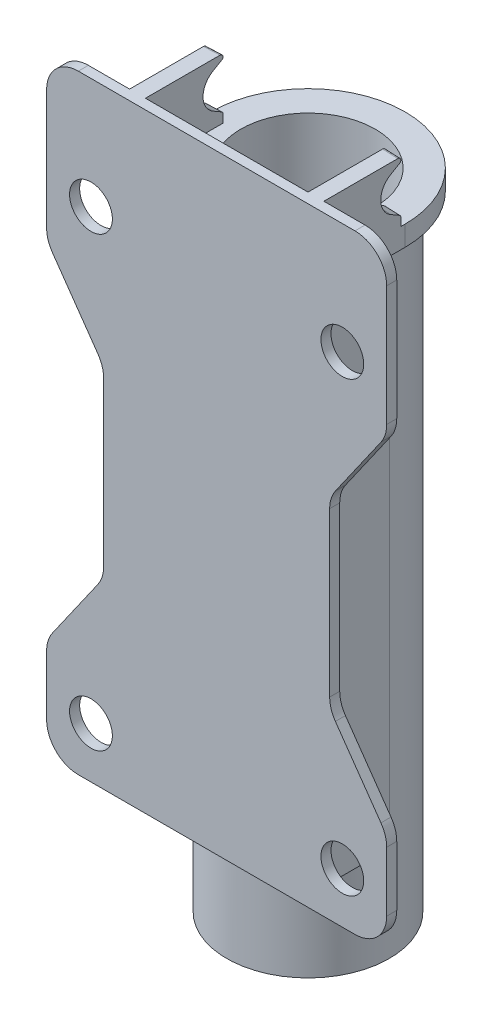
from build123d import *

# Parameters (mm, degrees)
BOSS_EXTRUDE1_START   = -173.2
BOSS_EXTRUDE1_DEPTH   = 173.2
BOSS_EXTRUDE2_DEPTH   = 3.175
M12_CLEARANCE_HOLE1_D = 13.5
FILLET1_R             = 10
FILLET1_OF_MIRROR1_R  = 10
BOSS_EXTRUDE3_DEPTH   = 6.35
BOSS_EXTRUDE4_DEPTH   = 19.05
CUT_EXTRUDE1_DEPTH    = 238.82533849
FILLET2_R             = 1
FILLET2_OF_MIRROR2_R  = 1


with BuildPart() as part:
    # Sketch12 → Revolve1 (revolve)
    with BuildSketch(Plane.XY, mode=Mode.PRIVATE) as revolve1_sk:
        Polygon((-25.65, 0), (-25.65, 203.2), (-21.22866, 203.2), (-21.22866, 164.7), (-19.177, 164.7), (-19.177, 38.5), (-21.22866, 38.5), (-21.22866, 0), align=None)
    revolve(revolve1_sk.sketch.rotate(Axis((0, 0, 0), (0, 1, 0)), 270), axis=Axis((0, 0, 0), (0, 1, 0)))

    # Sketch14 → Boss-Extrude1 (add)
    with BuildSketch(Plane(origin=(0, 30, 0), x_dir=(-1, 0, 0), z_dir=(0, -1, 0)).offset(BOSS_EXTRUDE1_START)):
        with BuildLine():
            Line((-25.65, 0), (-25.65, -25.65))
            Line((-25.65, -25.65), (1.5e-08, -25.65))
            ThreePointArc((1.5e-08, -25.65), (-18.137288932, -18.137288943), (-25.65, 0))
        make_face()
        with BuildLine():
            ThreePointArc((25.65, 0), (18.137288943, -18.137288932), (1.5e-08, -25.65))
            Line((1.5e-08, -25.65), (25.65, -25.65))
            Line((25.65, -25.65), (25.65, 0))
        make_face()
    extrude(amount=BOSS_EXTRUDE1_DEPTH)

    # Sketch27 → Boss-Extrude2 (add)
    with BuildSketch(Plane.XY.offset(25.65)):
        Polygon((-25.65, 30), (53.65, 30), (53.65, 62), (35.65, 87.706664121), (35.65, 145.493335879), (53.65, 171.2), (53.65, 222.25), (-25.65, 222.25), align=None)
    boss_extrude2 = extrude(amount=BOSS_EXTRUDE2_DEPTH)

    # M12 Clearance Hole1 (through all)
    with Locations(Plane(origin=(0, 0, 25.65), x_dir=(-1, 0, 0), z_dir=(0, 0, -1))):
        with Locations((-39.65, 46), (-39.65, 187.2)):
            m12_clearance_hole1 = Hole(M12_CLEARANCE_HOLE1_D / 2)

    # Fillet1
    fillet1_edges = [part.edges().sort_by_distance(p)[0] for p in [
        (53.65, 222.25, 27.2375),
        (53.65, 30, 27.2375),
        (53.65, 62, 27.2375),
        (35.65, 87.706664121, 27.2375),
        (35.65, 145.493335879, 27.2375),
        (53.65, 171.2, 27.2375),
    ]]
    fillet(fillet1_edges, radius=FILLET1_R)

    # Mirror1: Boss-Extrude2, M12 Clearance Hole1 across plane
    add(boss_extrude2.mirror(Plane(origin=(0, 0, 0), x_dir=(0, 0, 1), z_dir=(1, 0, 0))))
    add(m12_clearance_hole1.mirror(Plane(origin=(0, 0, 0), x_dir=(0, 0, 1), z_dir=(1, 0, 0))), mode=Mode.SUBTRACT)

    # Fillet1 of Mirror1
    fillet1_of_mirror1_edges = [part.edges().sort_by_distance(p)[0] for p in [
        (-53.65, 222.25, 27.2375),
        (-53.65, 30, 27.2375),
        (-53.65, 62, 27.2375),
        (-35.65, 87.706664121, 27.2375),
        (-35.65, 145.493335879, 27.2375),
        (-53.65, 171.2, 27.2375),
    ]]
    fillet(fillet1_of_mirror1_edges, radius=FILLET1_OF_MIRROR1_R)

    # Sketch33 → Boss-Extrude3 (add)
    with BuildSketch(Plane(origin=(0, 203.2, 0), x_dir=(1, 0, 0), z_dir=(0, 1, 0))):
        with BuildLine():
            Line((30.65, -25.65), (30.65, 0))
            ThreePointArc((30.65, 0), (0, 30.65), (-30.65, 0))
            Line((-30.65, 0), (-30.65, -25.65))
            Line((-30.65, -25.65), (-25.65, -25.65))
            Line((-25.65, -25.65), (-25.65, 0))
            ThreePointArc((-25.65, 0), (0, 25.65), (25.65, 0))
            Line((25.65, 0), (25.65, -25.65))
            Line((25.65, -25.65), (30.65, -25.65))
        make_face()
        Polygon((25.65, -25.65), (30.65, -25.65), (30.65, -1.3382079), (25.65, -1.119903186), align=None)
    extrude(amount=-BOSS_EXTRUDE3_DEPTH)

    # Sketch33<3> → Boss-Extrude4 (add)
    with BuildSketch(Plane(origin=(0, 203.2, 0), x_dir=(1, 0, 0), z_dir=(0, 1, 0))):
        Polygon((25.65, -25.65), (30.65, -25.65), (30.65, -1.3382079), (25.65, -1.119903186), align=None)
    boss_extrude4 = extrude(amount=BOSS_EXTRUDE4_DEPTH)

    # Sketch34 → Cut-Extrude1 (cut, symmetric)
    with BuildSketch(Plane(origin=(24.827906129, 0, 1.084009792), x_dir=(0.043619387365336035, 0, -0.9990482215818578), z_dir=(0.9990482215818577, 0, 0.04361938736533603))):
        with BuildLine():
            ThreePointArc((0, 219.9), (-1.643500936, 219.683628997), (-3.175, 219.049261314))
            Line((-3.175, 219.049261314), (0, 213.55))
            Line((0, 213.55), (0, 219.9))
        make_face()
        with BuildLine():
            Line((0, 213.55), (-3.175, 219.049261314))
            ThreePointArc((-3.175, 219.049261314), (-6.35, 213.55), (-3.175, 208.050738686))
            Line((-3.175, 208.050738686), (0, 213.55))
        make_face()
        with BuildLine():
            Line((0, 220.882348419), (-3.175, 219.049261314))
            ThreePointArc((-3.175, 219.049261314), (-1.643500936, 219.683628997), (0, 219.9))
            Line((0, 219.9), (0, 220.882348419))
        make_face()
        with BuildLine():
            Line((0, 207.2), (0, 213.55))
            Line((0, 213.55), (-3.175, 208.050738686))
            ThreePointArc((-3.175, 208.050738686), (-1.643500936, 207.416371003), (0, 207.2))
        make_face()
        with BuildLine():
            ThreePointArc((0, 207.2), (-1.643500936, 207.416371003), (-3.175, 208.050738686))
            Line((-3.175, 208.050738686), (0, 206.217651581))
            Line((0, 206.217651581), (0, 207.2))
        make_face()
    cut_extrude1 = extrude(amount=CUT_EXTRUDE1_DEPTH, both=True, mode=Mode.SUBTRACT)

    # Fillet2
    # the kernel refuses this fillet: 1 mm, written as the material it takes off along each edge
    with BuildSketch(Plane(origin=(33.147620554, 222.25, 1.447256369), x_dir=(-0.04361938736533601, 0, 0.9990482215818578), z_dir=(-0.9990482215818578, 0, -0.043619387365336))) as fillet2_piece_1:
        with BuildLine():
            CenterArc((FILLET2_R, -FILLET2_R), FILLET2_R, 90, 90)
            Line((0, -FILLET2_R), (0, 0))
            Line((0, 0), (FILLET2_R, 0))
        make_face()
    extrude(amount=10.004763426, mode=Mode.SUBTRACT)
    with BuildSketch(Plane(origin=(24.207998101, 220.882348419, 1.056944023), x_dir=(0, 1, 0), z_dir=(0.9990482215818578, 0, 0.043619387365336035))) as fillet2_piece_2:
        with BuildLine():
            CenterArc((FILLET2_R * 0.57735026919, FILLET2_R), FILLET2_R, 210, 60)
            Line((-FILLET2_R * 0.288675134595, FILLET2_R * 0.5), (0, 0))
            Line((0, 0), (FILLET2_R * 0.57735026919, 0))
        make_face()
    extrude(amount=7.891514772, mode=Mode.SUBTRACT)
    with BuildSketch(Plane(origin=(32.092001899, 206.217651581, 1.401167063), x_dir=(-0.03777549755589492, 0.5000000000000023, 0.8652011394955523), z_dir=(-0.9990482215818578, 0, -0.043619387365336035))) as fillet2_piece_3:
        with BuildLine():
            CenterArc((FILLET2_R * 0.57735026919, -FILLET2_R), FILLET2_R, 90, 60)
            Line((-FILLET2_R * 0.288675134595, -FILLET2_R * 0.5), (0, 0))
            Line((0, 0), (FILLET2_R * 0.57735026919, 0))
        make_face()
    extrude(amount=7.891514772, mode=Mode.SUBTRACT)

    # Mirror2: Boss-Extrude4, Cut-Extrude1 across plane
    add(boss_extrude4.mirror(Plane(origin=(0, 0, 0), x_dir=(0, 0, 1), z_dir=(1, 0, 0))))
    add(cut_extrude1.mirror(Plane(origin=(0, 0, 0), x_dir=(0, 0, 1), z_dir=(1, 0, 0))), mode=Mode.SUBTRACT)

    # Fillet2 of Mirror2
    # the kernel refuses this fillet: 1 mm, written as the material it takes off along each edge
    with BuildSketch(Plane(origin=(-33.147620554, 222.25, 1.447256369), x_dir=(0.04361938736533601, 0, 0.9990482215818578), z_dir=(0.9990482215818578, 0, -0.043619387365336))) as fillet2_of_mirror2_piece_1:
        with BuildLine():
            CenterArc((FILLET2_OF_MIRROR2_R, FILLET2_OF_MIRROR2_R), FILLET2_OF_MIRROR2_R, 180, 90)
            Line((0, FILLET2_OF_MIRROR2_R), (0, 0))
            Line((0, 0), (FILLET2_OF_MIRROR2_R, 0))
        make_face()
    extrude(amount=10.004763426, mode=Mode.SUBTRACT)
    with BuildSketch(Plane(origin=(-24.207998101, 220.882348419, 1.056944023), x_dir=(0, 1, 0), z_dir=(-0.9990482215818578, 0, 0.043619387365336035)), Plane(origin=(-32.092001899, 206.217651581, 1.401167063), x_dir=(0, -1, 0), z_dir=(0.9990482215818578, 0, -0.043619387365336035))) as fillet2_of_mirror2_piece_2:
        with BuildLine():
            CenterArc((FILLET2_OF_MIRROR2_R * 0.57735026919, -FILLET2_OF_MIRROR2_R), FILLET2_OF_MIRROR2_R, 90, 60)
            Line((-FILLET2_OF_MIRROR2_R * 0.288675134595, -FILLET2_OF_MIRROR2_R * 0.5), (0, 0))
            Line((0, 0), (FILLET2_OF_MIRROR2_R * 0.57735026919, 0))
        make_face()
    extrude(amount=7.891514772, mode=Mode.SUBTRACT)


solid = part.part
